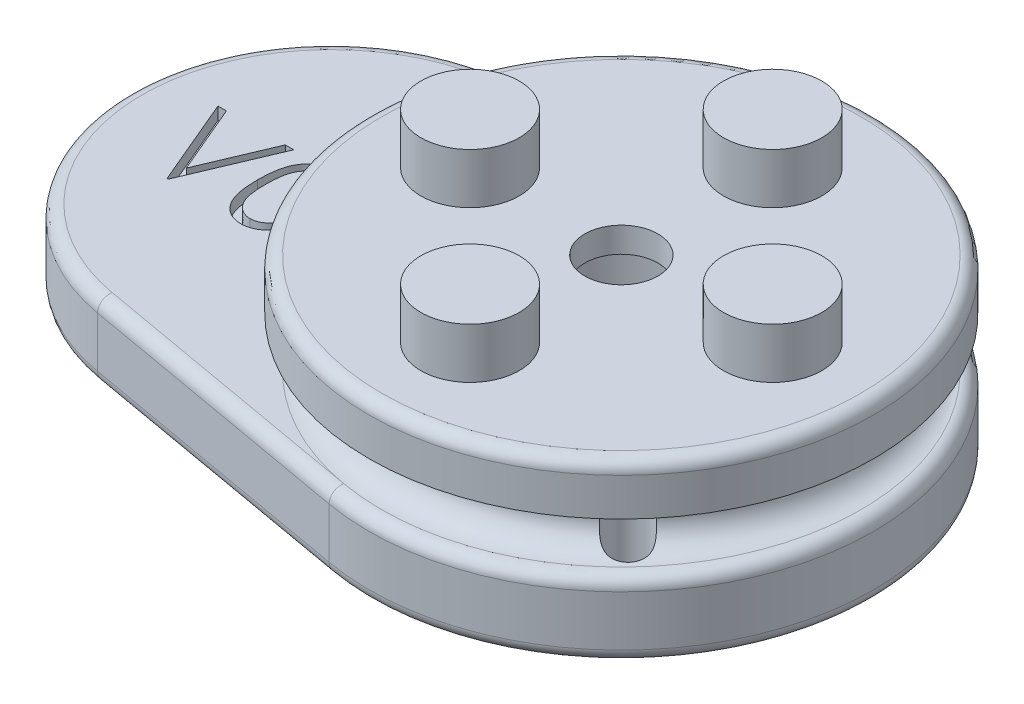
from build123d import *

# Parameters (mm, degrees)
BOSS_EXTRUDE1_DEPTH = 3
SKETCH2_R           = 1.5
CUT_EXTRUDE1_DEPTH  = 3
SKETCH3_R           = 8.5
BOSS_EXTRUDE2_DEPTH = 2
SKETCH4_R           = 10
BOSS_EXTRUDE3_DEPTH = 2
FILLET1_R           = 1
SKETCH6_R           = 3
CUT_EXTRUDE3_DEPTH  = 24.005434141
SKETCH7_R           = 1
CUT_EXTRUDE4_DEPTH  = 24.005434141
SKETCH8_R           = 0.8
CUT_EXTRUDE5_DEPTH  = 24.005434141
CUT_EXTRUDE6_DEPTH  = 0.5
FILLET3_R           = 0.5
FILLET4_R           = 0.5
SKETCH10_R          = 9.5
BOSS_EXTRUDE4_DEPTH = 2
SKETCH11_R          = 1.95
BOSS_EXTRUDE5_DEPTH = 2
CIRPATTERN1_COUNT   = 4
SKETCH12_R          = 1.45
CUT_EXTRUDE7_DEPTH  = 24.005434215
SKETCH13_R          = 3
CUT_EXTRUDE8_DEPTH  = 1


with BuildPart() as part:
    # Sketch1 → Boss-Extrude1 (new body)
    with BuildSketch(Plane(origin=(0, 0, 0), x_dir=(1, 0, 0), z_dir=(0, 1, 0))):
        with BuildLine():
            Line((-12.891304348, 7.878088106), (-1.739130435, 9.847610133))
            ThreePointArc((-1.739130435, 9.847610133), (10, 0), (-1.739130435, -9.847610133))
            Line((-1.739130435, -9.847610133), (-12.891304348, -7.878088106))
            ThreePointArc((-12.891304348, -7.878088106), (-19.5, 0), (-12.891304348, 7.878088106))
        make_face()
    extrude(amount=BOSS_EXTRUDE1_DEPTH)

    # Sketch2 → Cut-Extrude1 (cut)
    with BuildSketch(Plane(origin=(0, 3, 0), x_dir=(1, 0, 0), z_dir=(0, 1, 0))):
        with Locations(Location((0, 0, 0), (0, 0, 270))):
            Circle(SKETCH2_R)
    extrude(amount=-CUT_EXTRUDE1_DEPTH, mode=Mode.SUBTRACT)

    # Sketch3 → Boss-Extrude2 (add)
    with BuildSketch(Plane(origin=(0, 3, 0), x_dir=(1, 0, 0), z_dir=(0, 1, 0))):
        with Locations(Location((0, 0, 0), (0, 0, 270))):
            Circle(SKETCH3_R)
    extrude(amount=BOSS_EXTRUDE2_DEPTH)

    # Sketch4 → Boss-Extrude3 (add)
    with BuildSketch(Plane(origin=(0, 5, 0), x_dir=(1, 0, 0), z_dir=(0, 1, 0))):
        with Locations(Location((0, 0, 0), (0, 0, 270))):
            Circle(SKETCH4_R)
    extrude(amount=BOSS_EXTRUDE3_DEPTH)

    # Fillet1
    fillet1_edges = [part.edges().sort_by_distance(p)[0] for p in [
        (0, 3, -8.5),
        (0, 5, -8.5),
    ]]
    fillet(fillet1_edges, radius=FILLET1_R - 0.0001)  # a hair under: the kernel refuses the full size

    # Sketch6 → Cut-Extrude3 (cut, through all)
    with BuildSketch(Plane.XZ):
        with Locations(Location((0, 0, 0), (0, 0, 270))):
            Circle(SKETCH6_R)
    extrude(amount=-CUT_EXTRUDE3_DEPTH, mode=Mode.SUBTRACT)

    # Sketch7 → Cut-Extrude4 (cut, through all)
    with BuildSketch(Plane.XZ):
        with Locations(Location((0, 6, 0), (0, 0, 270))):
            Circle(SKETCH7_R)
        with Locations(Location((6, 0, 0), (0, 0, 270))):
            Circle(SKETCH7_R)
        with Locations(Location((0, -6, 0), (0, 0, 270))):
            Circle(SKETCH7_R)
        with Locations(Location((-6, 0, 0), (0, 0, 270))):
            Circle(SKETCH7_R)
    extrude(amount=-CUT_EXTRUDE4_DEPTH, mode=Mode.SUBTRACT)

    # Sketch8 → Cut-Extrude5 (cut, through all)
    with BuildSketch(Plane.XZ):
        with Locations(Location((6.138802983, 5.879208955, 0), (0, 0, 270))):
            Circle(SKETCH8_R)
    extrude(amount=-CUT_EXTRUDE5_DEPTH, mode=Mode.SUBTRACT)

    # Sketch9 → Cut-Extrude6 (cut)
    # profile 1 of 2: a face of its own
    with BuildSketch(Plane(origin=(0, 3, 0), x_dir=(1, 0, 0), z_dir=(0, 1, 0))):
        Polygon((-17.113040993, 1.116678908), (-16.776502532, 1.116678908), (-15.609835865, -1.641534233), (-14.443169198, 1.116678908), (-14.106630737, 1.116678908), (-15.587399968, -2.383321092), (-15.632271763, -2.383321092), align=None)
    # profile 2 of 2: a face of its own
    with BuildSketch(Plane(origin=(0, 3, 0), x_dir=(1, 0, 0), z_dir=(0, 1, 0))):
        with BuildLine():
            add(Edge.make_bspline(
                [(-13.792528173, -0.634723336), (-13.792200155, -0.578625948), (-13.791562975, -0.469655964), (-13.784474554, -0.310871322), (-13.772699211, -0.161911033), (-13.756561839, -0.022767967), (-13.736923858, 0.106593798), (-13.710708372, 0.225828555), (-13.680895569, 0.335488161), (-13.646343123, 0.43593021), (-13.607355334, 0.528507913), (-13.564921074, 0.614933114), (-13.517356279, 0.695075047), (-13.467379366, 0.770212837), (-13.412967295, 0.839116532), (-13.355668504, 0.902759194), (-13.293246628, 0.959669945), (-13.22782362, 1.011516247), (-13.158807155, 1.056965719), (-13.088164489, 1.096998457), (-13.015409383, 1.131198325), (-12.9403432, 1.158088761), (-12.863640642, 1.180299607), (-12.785033576, 1.195488555), (-12.704392212, 1.205045463), (-12.649960777, 1.205959131), (-12.622355897, 1.206422497)],
                knots=[0, 0, 0, 0, 1.646270934, 3.197905019, 4.663502075, 6.030701355, 7.308322542, 8.50163776, 9.611534131, 10.641858119, 11.616356847, 12.558055219, 13.465016945, 14.349605745, 15.204443733, 16.039544428, 16.859896111, 17.680448484, 18.487036065, 19.28249412, 20.06191084, 20.843045899, 21.620316918, 22.403196591, 23.190181807, 24, 24, 24, 24], degree=3))
            add(Edge.make_bspline(
                [(-12.622355897, 1.206422497), (-12.594520419, 1.205934682), (-12.53916441, 1.204964571), (-12.457324035, 1.195640629), (-12.377374353, 1.180169506), (-12.299656214, 1.158248531), (-12.223531228, 1.131052854), (-12.14959482, 1.096965737), (-12.077387738, 1.05728687), (-12.008057451, 1.010662993), (-11.940842836, 0.958680716), (-11.877394873, 0.899918048), (-11.817707787, 0.834968328), (-11.761032481, 0.764526465), (-11.708976884, 0.68724138), (-11.659403452, 0.60445727), (-11.615031416, 0.514726405), (-11.572296741, 0.419545937), (-11.535409754, 0.316282278), (-11.502143509, 0.205517518), (-11.47526454, 0.085943331), (-11.452875268, -0.041812914), (-11.435530372, -0.178220397), (-11.42289773, -0.322986713), (-11.416224645, -0.476207104), (-11.414967944, -0.580964953), (-11.414323045, -0.634723336)],
                knots=[0, 0, 0, 0, 0.810914788, 1.612654377, 2.396697861, 3.181598691, 3.963628158, 4.749916497, 5.551656086, 6.361998678, 7.18212741, 8.025565596, 8.878627764, 9.750805457, 10.657531673, 11.591944965, 12.560506719, 13.57287815, 14.630710178, 15.753379473, 16.941251878, 18.199788006, 19.531962791, 20.947069417, 22.433333509, 24, 24, 24, 24], degree=3))
            add(Edge.make_bspline(
                [(-11.414323045, -0.634723336), (-11.414974629, -0.688247244), (-11.416244215, -0.792536396), (-11.422822922, -0.945067371), (-11.435781553, -1.089065414), (-11.451991541, -1.224875877), (-11.474442504, -1.351933496), (-11.502047671, -1.470677944), (-11.532697993, -1.581622016), (-11.570532787, -1.683856827), (-11.611943498, -1.77880855), (-11.656998694, -1.867475699), (-11.70526852, -1.950641991), (-11.757857265, -2.027641738), (-11.813910678, -2.099020395), (-11.874628467, -2.163518018), (-11.938299052, -2.22268869), (-12.005711468, -2.275340317), (-12.076123019, -2.321425122), (-12.148082096, -2.362638972), (-12.22286548, -2.395871667), (-12.298778432, -2.424406708), (-12.376906798, -2.44620716), (-12.457153189, -2.461281016), (-12.539109425, -2.471852864), (-12.59451099, -2.472659344), (-12.622355897, -2.473064682)],
                knots=[0, 0, 0, 0, 1.561518951, 3.042555995, 4.452378317, 5.7783523, 7.031515105, 8.214008947, 9.334062868, 10.386615937, 11.391082383, 12.354592575, 13.286541444, 14.194233754, 15.072674879, 15.931287219, 16.775624067, 17.606195743, 18.42308326, 19.229000347, 20.022332153, 20.807536673, 21.593273796, 22.3848459, 23.188221202, 24, 24, 24, 24], degree=3))
            add(Edge.make_bspline(
                [(-12.622355897, -2.473064682), (-12.649960011, -2.472598327), (-12.704389936, -2.471678765), (-12.785042361, -2.462165033), (-12.863324805, -2.44686953), (-12.939623559, -2.425452926), (-13.014330074, -2.39923809), (-13.086426361, -2.365084406), (-13.156714044, -2.325750337), (-13.2250056, -2.280954916), (-13.290017761, -2.229633232), (-13.352116367, -2.172868944), (-13.409741386, -2.109245532), (-13.463375481, -2.039767609), (-13.51434957, -1.965074367), (-13.561238943, -1.884145994), (-13.604609797, -1.797303383), (-13.644253288, -1.703985473), (-13.679401951, -1.602830545), (-13.710449659, -1.492681366), (-13.734963817, -1.37256573), (-13.755946772, -1.243448363), (-13.772871155, -1.104774433), (-13.78442548, -0.956468655), (-13.791566795, -0.798623446), (-13.792201866, -0.690353671), (-13.792528173, -0.634723336)],
                knots=[0, 0, 0, 0, 0.810891512, 1.598919785, 2.382837074, 3.152667961, 3.926044502, 4.706494248, 5.493654104, 6.291793342, 7.103789334, 7.925228297, 8.761435821, 9.622817696, 10.50288917, 11.416980706, 12.369136599, 13.353924996, 14.394355917, 15.514179734, 16.714354668, 17.994756427, 19.357759367, 20.818452758, 22.365282078, 24, 24, 24, 24], degree=3))
        make_face()
        with BuildLine():
            add(Edge.make_bspline(
                [(-13.478425609, -0.633321092), (-13.478306162, -0.680069791), (-13.478074338, -0.770799836), (-13.472018138, -0.902643097), (-13.463767906, -1.025613426), (-13.453126609, -1.139866962), (-13.43732366, -1.245016975), (-13.419616872, -1.341786658), (-13.398068783, -1.429663895), (-13.372573765, -1.509251706), (-13.343534668, -1.581900774), (-13.311828804, -1.649501989), (-13.277768081, -1.712853926), (-13.239648931, -1.771387534), (-13.198133868, -1.825293698), (-13.154160608, -1.87552653), (-13.106088024, -1.920323512), (-13.039584282, -1.974050367), (-12.951787807, -2.029569501), (-12.841167352, -2.07791559), (-12.727498901, -2.108298047), (-12.650347651, -2.112161803), (-12.61183907, -2.114090323)],
                knots=[0, 0, 0, 0, 1.459021318, 2.831673884, 4.118529203, 5.306027144, 6.411944654, 7.436330062, 8.375795394, 9.233974572, 10.042671642, 10.816086306, 11.563610507, 12.285937304, 12.993564865, 13.685989202, 14.367179055, 15.041617293, 16.353048772, 17.594441528, 18.799311195, 20, 20, 20, 20], degree=3))
            add(Edge.make_bspline(
                [(-12.61183907, -2.114090323), (-12.573081399, -2.112492542), (-12.495646075, -2.109300279), (-12.38251228, -2.078501542), (-12.27268201, -2.032032003), (-12.18661007, -1.977084497), (-12.121127526, -1.924756168), (-12.074210536, -1.880141519), (-12.031148488, -1.830185652), (-11.990306413, -1.776286356), (-11.952847337, -1.717413872), (-11.9187842, -1.653851297), (-11.887700852, -1.585422119), (-11.869991806, -1.53765238), (-11.860937628, -1.513228945)],
                knots=[0, 0, 0, 0, 1.353760809, 2.704726607, 4.075137775, 5.516104923, 6.260822281, 7.007110065, 7.778089737, 8.566572457, 9.372053459, 10.217411131, 11.088608312, 12, 12, 12, 12], degree=3))
            add(Edge.make_bspline(
                [(-11.860937628, -1.513228945), (-11.85038586, -1.481999205), (-11.828961246, -1.418589441), (-11.801349472, -1.320225789), (-11.779604073, -1.217023025), (-11.760040707, -1.109597908), (-11.746687651, -0.997158207), (-11.735939838, -0.880051824), (-11.729609151, -0.758190461), (-11.7288244, -0.67539547), (-11.728425609, -0.633321092)],
                knots=[0, 0, 0, 0, 0.884706709, 1.796334032, 2.740027952, 3.714592787, 4.726048262, 5.777819803, 6.87074269, 8, 8, 8, 8], degree=3))
            add(Edge.make_bspline(
                [(-11.728425609, -0.633321092), (-11.728975798, -0.59125352), (-11.730052086, -0.508960355), (-11.734166073, -0.388442174), (-11.744789648, -0.273974413), (-11.756588767, -0.165063941), (-11.773985988, -0.062313638), (-11.792743795, 0.035136667), (-11.817945007, 0.126079692), (-11.844864782, 0.211939274), (-11.875675178, 0.291739928), (-11.909590912, 0.365853715), (-11.945812671, 0.434638439), (-11.985154911, 0.497905381), (-12.027150594, 0.555937924), (-12.072908143, 0.607572518), (-12.120612516, 0.654409486), (-12.187429702, 0.707872056), (-12.274903992, 0.762383751), (-12.383749639, 0.812549511), (-12.497020283, 0.841357804), (-12.573593737, 0.845419491), (-12.61183907, 0.847448138)],
                knots=[0, 0, 0, 0, 1.31362396, 2.569729283, 3.763502607, 4.902122613, 5.988968491, 7.01645872, 7.998833611, 8.933434873, 9.825090667, 10.667526885, 11.477055099, 12.250526234, 12.991942729, 13.710640831, 14.402115721, 15.076753259, 16.378508321, 17.609869233, 18.806226677, 20, 20, 20, 20], degree=3))
            add(Edge.make_bspline(
                [(-12.61183907, 0.847448138), (-12.650549662, 0.845416692), (-12.728041368, 0.841350098), (-12.842489323, 0.812656844), (-12.952193674, 0.762643878), (-13.039436649, 0.707691506), (-13.106300436, 0.655353194), (-13.153383129, 0.60996674), (-13.197529301, 0.560320486), (-13.238197001, 0.505918571), (-13.276286284, 0.447453204), (-13.311267297, 0.384464439), (-13.342784627, 0.316633075), (-13.371869163, 0.244016639), (-13.397441951, 0.164435695), (-13.418535914, 0.076666701), (-13.438022967, -0.019795191), (-13.451818236, -0.125514698), (-13.464081992, -0.239796852), (-13.47196334, -0.36307417), (-13.478094597, -0.49513855), (-13.478313062, -0.586337709), (-13.478425609, -0.633321092)],
                knots=[0, 0, 0, 0, 1.207732386, 2.417664972, 3.655092373, 4.956220595, 5.625982001, 6.301752483, 6.994047911, 7.697131622, 8.419323945, 9.170223765, 9.943494443, 10.752040957, 11.610060368, 12.549350801, 13.567764191, 14.679664412, 15.874934091, 17.154273443, 18.533957287, 20, 20, 20, 20], degree=3))
        make_face(mode=Mode.SUBTRACT)
    extrude(amount=-CUT_EXTRUDE6_DEPTH, mode=Mode.SUBTRACT)

    # Fillet3
    fillet3_edges = [part.edges().sort_by_distance(p)[0] for p in [
        (-19.5, 3, 0),
        (-7.315217391, 3, 8.86284912),
        (10, 3, 0),
        (-7.315217391, 0, 8.86284912),
        (-19.5, 0, 0),
        (-7.315217391, 0, -8.86284912),
        (10, 0, 0),
        (-7.315217391, 3, -8.86284912),
    ]]
    fillet(fillet3_edges, radius=FILLET3_R)

    # Fillet4
    fillet4_edges = [part.edges().sort_by_distance(p)[0] for p in [
        (0, 7, -10),
    ]]
    fillet(fillet4_edges, radius=FILLET4_R)

    # Sketch10 → Boss-Extrude4 (add)
    with BuildSketch(Plane(origin=(0, 7, 0), x_dir=(1, 0, 0), z_dir=(0, 1, 0))):
        Circle(SKETCH10_R)
    extrude(amount=-BOSS_EXTRUDE4_DEPTH)

    # Sketch11 → Boss-Extrude5 (add)
    with BuildSketch(Plane(origin=(0, 7, 0), x_dir=(1, 0, 0), z_dir=(0, 1, 0))):
        with Locations(Location((0, 6, 0), (0, 0, 270))):
            Circle(SKETCH11_R)
    boss_extrude5 = extrude(amount=BOSS_EXTRUDE5_DEPTH)

    # CirPattern1: Boss-Extrude5 ×4 about axis
    cirpattern1_axis = Axis((0, 0, 0), (0, 1, 0))
    for i in range(1, CIRPATTERN1_COUNT):
        add(boss_extrude5.rotate(cirpattern1_axis, i * 360 / CIRPATTERN1_COUNT))

    # Sketch12 → Cut-Extrude7 (cut, through all)
    with BuildSketch(Plane(origin=(0, 7, 0), x_dir=(1, 0, 0), z_dir=(0, 1, 0))):
        with Locations(Location((0, 0, 0), (0, 0, 270))):
            Circle(SKETCH12_R)
    extrude(amount=-CUT_EXTRUDE7_DEPTH, mode=Mode.SUBTRACT)

    # Sketch13 → Cut-Extrude8 (cut)
    with BuildSketch(Plane.XZ.offset(-5)):
        with Locations(Location((0, 0, 0), (0, 0, 270))):
            Circle(SKETCH13_R)
    extrude(amount=-CUT_EXTRUDE8_DEPTH, mode=Mode.SUBTRACT)


solid = part.part
